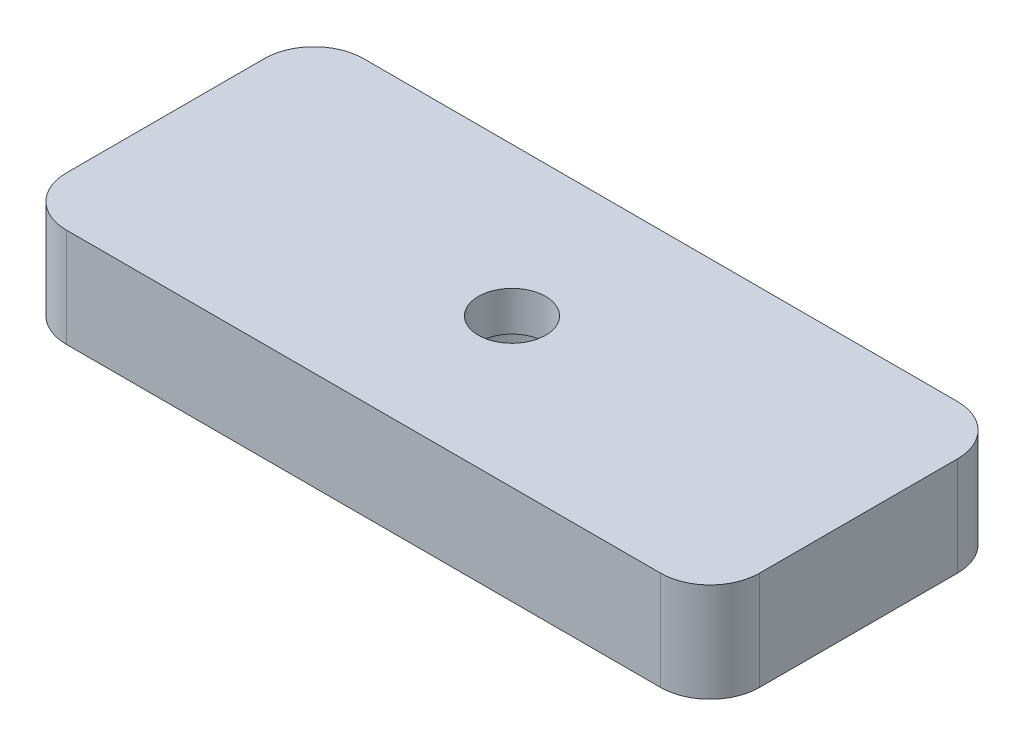
from build123d import *

# Parameters (mm, degrees)
SKETCH1_W                      = 35
SKETCH1_H                      = 15
BOSS_EXTRUDE1_DEPTH            = 5
CBORE_FOR_M3_SHCS2_D           = 3.4
CBORE_FOR_M3_SHCS2_CBORE_D     = 6.5
CBORE_FOR_M3_SHCS2_CBORE_DEPTH = 3
FILLET1_R                      = 2.5


with BuildPart() as part:
    # Sketch1 → Boss-Extrude1 (new body)
    with BuildSketch(Plane(origin=(0, 0, 0), x_dir=(1, 0, 0), z_dir=(0, 1, 0))):
        with Locations((17.5, 7.5)):
            Rectangle(SKETCH1_W, SKETCH1_H)
    extrude(amount=BOSS_EXTRUDE1_DEPTH)

    # CBORE for M3 SHCS2 (through all)
    with Locations(Plane(origin=(0, 0, 0), x_dir=(-1, 0, 0), z_dir=(0, -1, 0))):
        with Locations((-17.5, 7.5)):
            CounterBoreHole(CBORE_FOR_M3_SHCS2_D / 2, CBORE_FOR_M3_SHCS2_CBORE_D / 2, CBORE_FOR_M3_SHCS2_CBORE_DEPTH)

    # Fillet1
    fillet1_edges = [part.edges().sort_by_distance(p)[0] for p in [
        (0, 2.5, -15),
        (0, 2.5, 0),
        (35, 2.5, 0),
        (35, 2.5, -15),
    ]]
    fillet(fillet1_edges, radius=FILLET1_R)


solid = part.part
